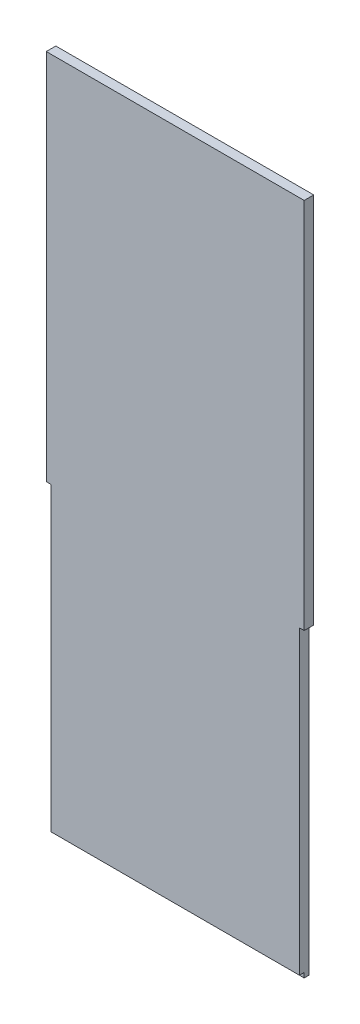
from build123d import *

# Parameters (mm, degrees)
BOSS_EXTRUDE1_DEPTH = 12.7
SKETCH2_W           = 330.2
SKETCH2_H           = 6.35
CUT_EXTRUDE1_DEPTH  = 6.35


with BuildPart() as part:
    # Sketch1 → Boss-Extrude1 (new body)
    with BuildSketch(Plane.XY):
        Polygon((0, 406.4), (-6.35, 406.4), (-6.35, 901.7), (336.55, 901.7), (336.55, 406.4), (330.2, 406.4), (330.2, 0), (0, 0), align=None)
    extrude(amount=BOSS_EXTRUDE1_DEPTH)

    # Sketch2 → Cut-Extrude1 (cut)
    with BuildSketch(Plane.XY.offset(12.7)):
        with Locations((165.1, 3.175)):
            Rectangle(SKETCH2_W, SKETCH2_H)
    extrude(amount=-CUT_EXTRUDE1_DEPTH, mode=Mode.SUBTRACT)


solid = part.part
